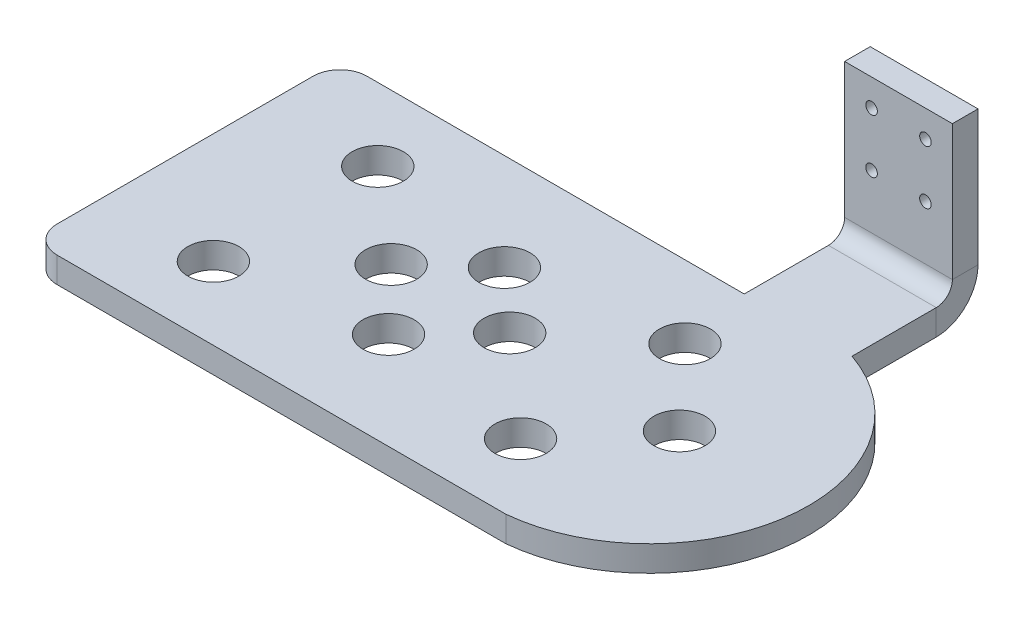
from build123d import *

# Parameters (mm, degrees)
SKETCH1_R                  = 9.5
SKETCH1_R_2                = 2.15
BASE_FLANGE1_DEPTH         = 9.5
SKETCHED_START             = -98.25
SKETCHED_BEND1_OUTLINE_W   = 40
SKETCHED_BEND1_OUTLINE_H   = 9.5
SKETCHED_BEND1_DEPTH       = 51.5
SKETCHED_START_2           = -45.24247
SKETCHED_BEND1_2_OUTLINE_W = 40
SKETCHED_BEND1_2_OUTLINE_H = 56.113939487
SKETCHED_BEND1_2_OUTLINE_R = 2.15
SKETCHED_BEND1_2_DEPTH     = 7.99247
SKETCHED_START_3           = -46.75
SKETCHED_BEND1_3_OUTLINE_W = 40
SKETCHED_BEND1_3_OUTLINE_H = 56.113939487
SKETCHED_BEND1_3_OUTLINE_R = 2.15
SKETCHED_BEND1_3_DEPTH     = 15.5
SKETCHED_START_4           = 150
SKETCHED_BEND1_4_DEPTH     = 40


with BuildPart() as part:
    # Base-Flange1: sheet metal written as solids
    # Sketch1 → Base-Flange1 (new body)
    with BuildSketch(Plane(origin=(0, 0, 0), x_dir=(1, 0, 0), z_dir=(0, 1, 0))):
        with BuildLine():
            Line((0, -105), (0, -10))
            ThreePointArc((0, -10), (2.928932188, -2.928932188), (10, 0))
            Line((10, 0), (150, 0))
            Line((150, 0), (150, 98.25))
            Line((150, 98.25), (190, 98.25))
            Line((190, 98.25), (190, 0))
            ThreePointArc((190, 0), (229.599557186, -62.912629471), (176.5615547, -115))
            Line((176.5615547, -115), (10, -115))
            ThreePointArc((10, -115), (2.928932188, -112.071067812), (0, -105))
        make_face()
        with Locations(Location((41, -27, 0), (0, 0, 270))):
            Circle(SKETCH1_R, mode=Mode.SUBTRACT)
        with Locations(Location((41, -88, 0), (0, 0, 270))):
            Circle(SKETCH1_R, mode=Mode.SUBTRACT)
        with Locations(Location((160, 88.25, 0), (0, 0, 270))):
            Circle(SKETCH1_R_2, mode=Mode.SUBTRACT)
        with Locations(Location((180, 88.25, 0), (0, 0, 270))):
            Circle(SKETCH1_R_2, mode=Mode.SUBTRACT)
        with Locations(Location((180, 68.25, 0), (0, 0, 270))):
            Circle(SKETCH1_R_2, mode=Mode.SUBTRACT)
        with Locations(Location((160, 68.25, 0), (0, 0, 270))):
            Circle(SKETCH1_R_2, mode=Mode.SUBTRACT)
        with Locations(Location((75, -56.035702904, 0), (0, 0, 270))):
            Circle(SKETCH1_R, mode=Mode.SUBTRACT)
        with Locations(Location((119, -56.035702904, 0), (0, 0, 270))):
            Circle(SKETCH1_R, mode=Mode.SUBTRACT)
        with Locations(Location((97, -36, 0), (0, 0, 270))):
            Circle(SKETCH1_R, mode=Mode.SUBTRACT)
        with Locations(Location((97, -79, 0), (0, 0, 270))):
            Circle(SKETCH1_R, mode=Mode.SUBTRACT)
        with Locations(Location((155, -27, 0), (0, 0, 270))):
            Circle(SKETCH1_R, mode=Mode.SUBTRACT)
        with Locations(Location((182, -56.035702904, 0), (0, 0, 270))):
            Circle(SKETCH1_R, mode=Mode.SUBTRACT)
        with Locations(Location((155, -88, 0), (0, 0, 270))):
            Circle(SKETCH1_R, mode=Mode.SUBTRACT)
    extrude(amount=BASE_FLANGE1_DEPTH)

    # Sketched Bend1: read off the stored shape, not the designer's step
    # Sketched Bend1 outline → Sketched Bend1 (cut)
    with BuildSketch(Plane.XY.offset(SKETCHED_START)):
        with Locations((170, 4.75)):
            Rectangle(SKETCHED_BEND1_OUTLINE_W, SKETCHED_BEND1_OUTLINE_H)
    extrude(amount=SKETCHED_BEND1_DEPTH, mode=Mode.SUBTRACT)

    # Sketched Bend1 2 outline → Sketched Bend1 2 (add)
    with BuildSketch(Plane.XY.offset(SKETCHED_START_2)):
        with Locations((170, 37.556969744)):
            Rectangle(SKETCHED_BEND1_2_OUTLINE_W, SKETCHED_BEND1_2_OUTLINE_H)
        with Locations((160, 35.613939487)):
            Circle(SKETCHED_BEND1_2_OUTLINE_R, mode=Mode.SUBTRACT)
        with Locations((160, 55.613939487)):
            Circle(SKETCHED_BEND1_2_OUTLINE_R, mode=Mode.SUBTRACT)
        with Locations((180, 35.613939487)):
            Circle(SKETCHED_BEND1_2_OUTLINE_R, mode=Mode.SUBTRACT)
        with Locations((180, 55.613939487)):
            Circle(SKETCHED_BEND1_2_OUTLINE_R, mode=Mode.SUBTRACT)
    extrude(amount=SKETCHED_BEND1_2_DEPTH)

    # Sketched Bend1 3 outline → Sketched Bend1 3 (add)
    with BuildSketch(Plane.XY.offset(SKETCHED_START_3)):
        with Locations((170, 37.556969744)):
            Rectangle(SKETCHED_BEND1_3_OUTLINE_W, SKETCHED_BEND1_3_OUTLINE_H)
        with Locations((160, 35.613939487)):
            Circle(SKETCHED_BEND1_3_OUTLINE_R, mode=Mode.SUBTRACT)
        with Locations((180, 35.613939487)):
            Circle(SKETCHED_BEND1_3_OUTLINE_R, mode=Mode.SUBTRACT)
        with Locations((160, 55.613939487)):
            Circle(SKETCHED_BEND1_3_OUTLINE_R, mode=Mode.SUBTRACT)
        with Locations((180, 55.613939487)):
            Circle(SKETCHED_BEND1_3_OUTLINE_R, mode=Mode.SUBTRACT)
    extrude(amount=SKETCHED_BEND1_3_DEPTH)

    # Sketched Bend1 4 outline → Sketched Bend1 4 (cut)
    with BuildSketch(Plane.YZ.offset(SKETCHED_START_4)):
        with BuildLine():
            ThreePointArc((9.5, -31.25), (11.257359313, -35.492640687), (15.5, -37.25))
            Line((15.5, -37.25), (65.613939487, -37.25))
            Line((65.613939487, -37.25), (65.613939487, -31.25))
            Line((65.613939487, -31.25), (9.5, -31.25))
        make_face()
        with BuildLine():
            Line((0, -46.75), (15.5, -46.75))
            ThreePointArc((15.5, -46.75), (4.539844892, -42.210155108), (0, -31.25))
            Line((0, -31.25), (0, -46.75))
        make_face()
    extrude(amount=SKETCHED_BEND1_4_DEPTH, mode=Mode.SUBTRACT)


solid = part.part
